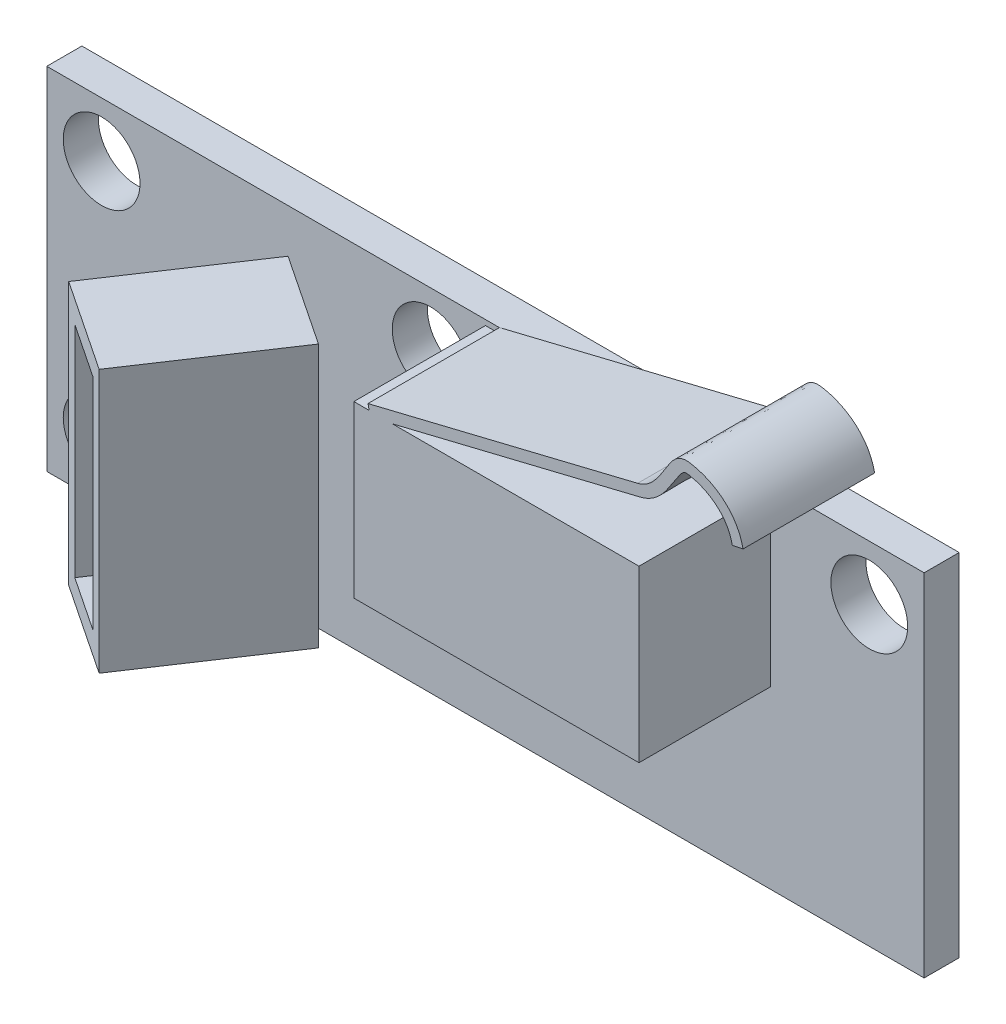
from build123d import *

# Parameters (mm, degrees)
SKETCH1_W           = 40
SKETCH1_H           = 16
SKETCH1_R           = 1.75
EXTRUDE1_DEPTH      = 1.6
SKETCH2_W           = 13
SKETCH2_H           = 7.760900167
EXTRUDE2_DEPTH      = 6
EXTRUDE_THIN1_START = -6
EXTRUDE_THIN1_DEPTH = 6
EXTRUDE3_DEPTH      = 6
EXTRUDE3_DEPTH_BACK = 6
SHELL1_T            = -1
EXTRUDE4_DEPTH      = 6
EXTRUDE4_DEPTH_BACK = 6


# Read off the part's stored shape, not the designer's step: Extrude-Thin1
with BuildPart() as part:
    # Sketch1 → Extrude1 (new body)
    with BuildSketch(Plane.XY):
        Rectangle(SKETCH1_W, SKETCH1_H)
        with Locations((-17.5, 5.5)):
            Circle(SKETCH1_R, mode=Mode.SUBTRACT)
        with Locations(Location((17.5, 5.5, 0), (0, 0, 180))):
            Circle(SKETCH1_R, mode=Mode.SUBTRACT)
        with Locations(Location((-17.5, -5.5, 0), (0, 0, 180))):
            Circle(SKETCH1_R, mode=Mode.SUBTRACT)
        with Locations((-2.5, 5.5)):
            Circle(SKETCH1_R, mode=Mode.SUBTRACT)
    extrude(amount=EXTRUDE1_DEPTH)

    # Sketch2 → Extrude2 (add)
    with BuildSketch(Plane.XY.offset(1.6)):
        with Locations((6.5, 3.880450084)):
            Rectangle(SKETCH2_W, SKETCH2_H)
    extrude(amount=EXTRUDE2_DEPTH)

    # Extrude-Thin1 outline → Extrude-Thin1 (add)
    with BuildSketch(Plane.XY.offset(7.6).offset(EXTRUDE_THIN1_START)):
        with BuildLine():
            Line((1.75628065, 7.760900167), (13.059245146, 10.51802157))
            add(Edge.make_bspline(
                [(13.059245146, 10.51802157), (13.258392783, 10.566599464), (13.436578776, 10.646382088), (13.751079076, 10.845085733), (13.887567817, 10.963617525), (14.248802057, 11.343386603), (14.427398427, 11.628835129), (14.659201777, 12.00094611), (14.730292096, 12.115741352), (14.863522365, 12.307378975), (14.926209875, 12.383669897), (15.005501687, 12.455780424), (15.029150989, 12.472768865), (15.068625166, 12.494907839), (15.08339758, 12.500317873), (15.14331693, 12.513390547), (15.202781043, 12.513126448), (15.322823552, 12.493735016), (15.368276479, 12.484388221), (15.460759179, 12.463022362), (15.50815066, 12.450773554), (15.652759011, 12.409108117), (15.752400152, 12.374767578), (16.053339356, 12.250496873), (16.25646151, 12.139308703), (16.630808407, 11.853191446), (16.802050862, 11.678608174), (17.082562235, 11.255189844), (17.192418017, 11.006263961), (17.255436889, 10.709045709)],
                knots=[0, 0, 0, 0, 0.0625, 0.0625, 0.125, 0.125, 0.25, 0.25, 0.3125, 0.3125, 0.375, 0.375, 0.40625, 0.40625, 0.4375, 0.4375, 0.5, 0.5, 0.53125, 0.53125, 0.5625, 0.5625, 0.625, 0.625, 0.75, 0.75, 0.875, 0.875, 1, 1, 1, 1], degree=3))
            Line((17.255436889, 10.709045709), (17.744563111, 10.812754625))
            add(Edge.make_bspline(
                [(12.940754854, 11.003778764), (13.084783094, 11.038911435), (13.210931122, 11.095251055), (13.442595629, 11.241618426), (13.547937674, 11.332035405), (13.841211649, 11.640357194), (14.004308568, 11.895295314), (14.234159709, 12.264272438), (14.308473314, 12.384924588), (14.464269553, 12.609020967), (14.545204627, 12.713016654), (14.691396043, 12.845967835), (14.74458271, 12.886438595), (14.86402781, 12.953429018), (14.931498353, 12.978939177), (15.127379677, 13.021674833), (15.250100345, 13.011964204), (15.418766988, 12.984718125), (15.472161624, 12.973557856), (15.58197057, 12.948189193), (15.637961747, 12.933712021), (15.808431424, 12.884595261), (15.925415704, 12.844275322), (16.279829349, 12.697922726), (16.520911208, 12.566506205), (16.973610567, 12.22050334), (17.185210355, 12.005571181), (17.533055699, 11.480515482), (17.668714391, 11.170482767), (17.744563111, 10.812754625)],
                knots=[0, 0, 0, 0, 0.0625, 0.0625, 0.125, 0.125, 0.25, 0.25, 0.3125, 0.3125, 0.375, 0.375, 0.40625, 0.40625, 0.4375, 0.4375, 0.5, 0.5, 0.53125, 0.53125, 0.5625, 0.5625, 0.625, 0.625, 0.75, 0.75, 0.875, 0.875, 1, 1, 1, 1], degree=3))
            Line((12.940754854, 11.003778764), (0.642096752, 8.003778764))
            Line((0.642096752, 8.003778764), (0.701341897, 7.760900167))
            Line((0.701341897, 7.760900167), (1.75628065, 7.760900167))
        make_face()
    extrude(amount=EXTRUDE_THIN1_DEPTH)

    # Sketch5 → Extrude4 (add, two sides: drawn at the far end of the back side and taken through both)
    with BuildSketch(Plane(origin=(0, 0, 0), x_dir=(1, 0, 0), z_dir=(0, 1, 0)).offset(-EXTRUDE4_DEPTH_BACK)):
        Polygon((-9.736964899, 0), (-9.458111879, 2), (-8.535084126, 2), (-8.263035101, 0), align=None)
    extrude(amount=EXTRUDE4_DEPTH + EXTRUDE4_DEPTH_BACK)


with BuildPart() as body_2:
    # Sketch4 → Extrude3 (new, two sides: drawn at the far end of the back side and taken through both)
    with BuildSketch(Plane(origin=(0, 0, 0), x_dir=(1, 0, 0), z_dir=(0, 1, 0)).offset(-EXTRUDE3_DEPTH_BACK)):
        Polygon((-13, -7.6), (-9, -1.6), (-4.839748528, -4.373500981), (-8.839748528, -10.373500981), align=None)
    extrude(amount=EXTRUDE3_DEPTH + EXTRUDE3_DEPTH_BACK)

    # Shell1
    shell1_openings = [body_2.faces().sort_by_distance(p)[0] for p in [
        (-10.919874264, 0, 8.986750491),
    ]]
    offset(amount=SHELL1_T, openings=shell1_openings, kind=Kind.INTERSECTION)


solid = Compound([part.part, body_2.part])
